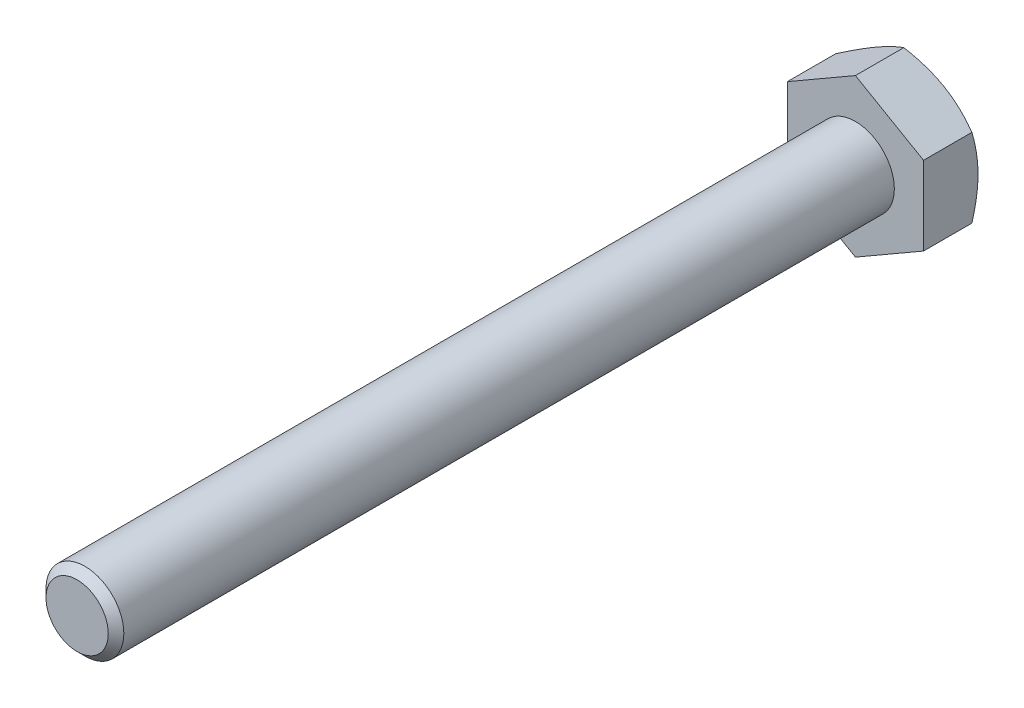
from build123d import *

# Parameters (mm, degrees)
ESQUISSE1_W        = 2
ESQUISSE1_H        = 40
BOSS_EXTRU_1_DEPTH = 2.8


with BuildPart() as part:
    # Esquisse1 → Base-Révolution (revolve)
    with BuildSketch(Plane(origin=(0, 0, 0), x_dir=(1, 0, 0), z_dir=(0, 1, 0))):
        with Locations((1, -20)):
            Rectangle(ESQUISSE1_W, ESQUISSE1_H)
    revolve(axis=Axis((0, 0, 0), (0, 0, 1)))

    # Chanfrein1: read off the stored shape, not the designer's step
    # Chanfrein1 outline → Chanfrein1 (revolve, cut)
    with BuildSketch(Plane.XZ):
        Polygon((2, 40), (1.6, 40), (2, 39.6), align=None)
    revolve(axis=Axis((0, 0, 0), (0, 0, 1)), mode=Mode.SUBTRACT)

    # Esquisse6 → Boss.-Extru.1 (add)
    with BuildSketch(Plane.XY):
        Polygon((3.5, -2.020725942), (3.5, 2.020725942), (0, 4.041451884), (-3.5, 2.020725942), (-3.5, -2.020725942), (0, -4.041451884), align=None)
    extrude(amount=-BOSS_EXTRU_1_DEPTH)

    # Esquisse7 → Enlèvement de matière-Révolution1 (revolve, cut)
    with BuildSketch(Plane(origin=(0, 0, 0), x_dir=(1, 0, 0), z_dir=(0, 1, 0))):
        Polygon((-3.5, 2.8), (-8.349742261, 2.8), (-8.349742261, 0), align=None)
    revolve(axis=Axis((0, 0, -6.239446496), (0, 0, 1)), mode=Mode.SUBTRACT)


solid = part.part
